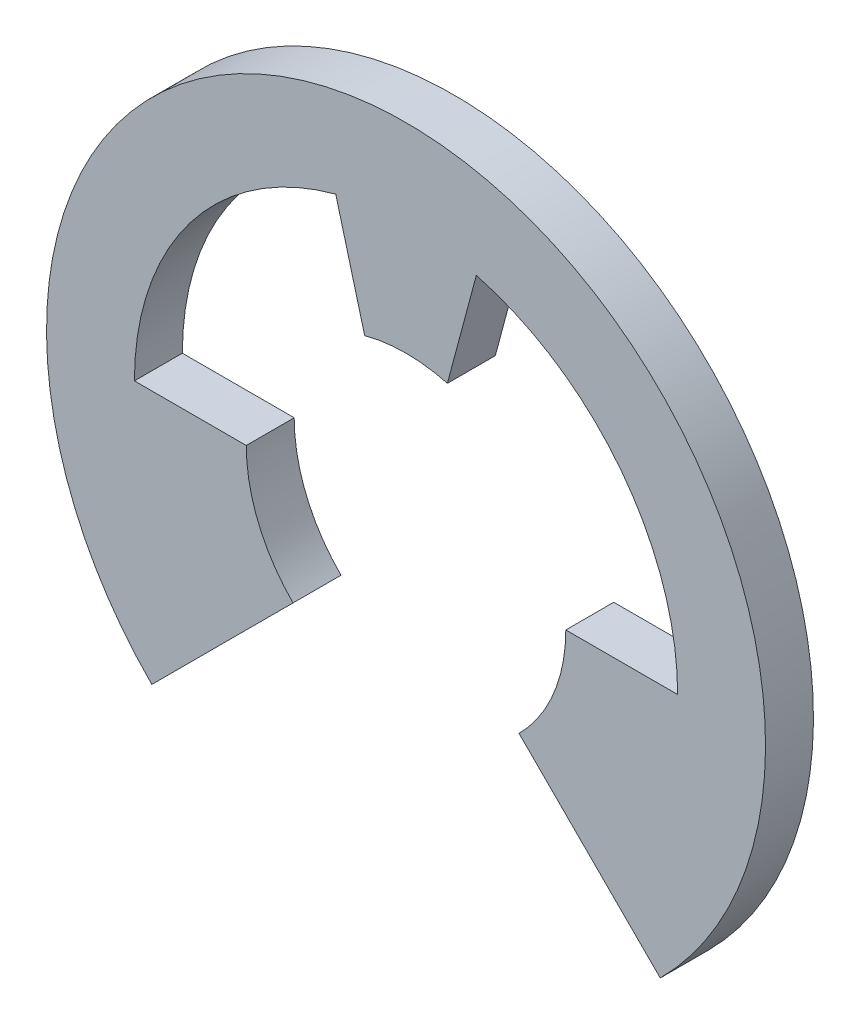
from build123d import *

# Parameters (mm, degrees)
EXTRUDE_1_DEPTH = 0.6


with BuildPart() as part:
    # 草图1 → 凸台-拉伸1 (new body)
    with BuildSketch(Plane.XY.offset(0.6)):
        with BuildLine():
            Line((1.414213562, -1.414213562), (3.181980515, -3.181980515))
            ThreePointArc((3.181980515, -3.181980515), (0, 4.5), (-3.181980515, -3.181980515))
            Line((-3.181980515, -3.181980515), (-1.414213562, -1.414213562))
            ThreePointArc((-1.414213562, -1.414213562), (-1.847759065, -0.765366865), (-2, 0))
            Line((-2, 0), (-3.4, 0))
            ThreePointArc((-3.4, 0), (-2.697401328, 2.069788896), (-0.879984662, 3.284147834))
            Line((-0.879984662, 3.284147834), (-0.517638037, 1.931851667))
            ThreePointArc((-0.517638037, 1.931851667), (4.4e-08, 2), (0.517638122, 1.931851644))
            Line((0.517638122, 1.931851644), (0.879984807, 3.284147795))
            ThreePointArc((0.879984807, 3.284147795), (2.697401374, 2.069788837), (3.4, 0))
            Line((3.4, 0), (2, 0))
            ThreePointArc((2, 0), (1.847759065, -0.765366865), (1.414213562, -1.414213562))
        make_face()
    extrude(amount=-EXTRUDE_1_DEPTH)


solid = part.part
